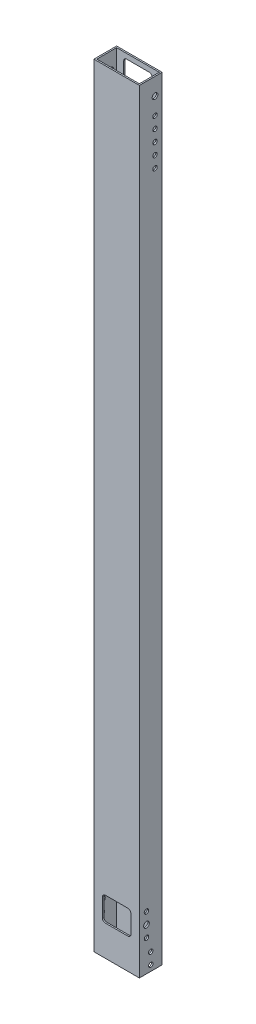
from build123d import *

# Parameters (mm, degrees)
SKETCH1_W               = 50.8
SKETCH1_H               = 863.6
BOSS_EXTRUDE1_DEPTH     = 12.7
SHELL1_T                = -1.5875
CUT_EXTRUDE1_DEPTH      = 433.73281595
CUT_EXTRUDE1_DEPTH_BACK = 433.73281595
SKETCH3_R               = 2.4892
CUT_EXTRUDE2_DEPTH      = 433.73281595
CUT_EXTRUDE2_DEPTH_BACK = 433.73281595
SKETCH4_R               = 3.175
SKETCH4_R_2             = 2.4892
SKETCH5_W               = 31.75
SKETCH5_H               = 26.9875
CUT_EXTRUDE3_DEPTH      = 433.73281595
FILLET1_R               = 3.175
CUT_EXTRUDE4_DEPTH      = 433.73281595
CUT_EXTRUDE4_DEPTH_BACK = 433.73281595
SKETCH6_R               = 3.175
SKETCH7_W               = 31.75
SKETCH7_H               = 26.9875
CUT_EXTRUDE5_DEPTH      = 433.73281595
FILLET2_R               = 3.175
CUT_EXTRUDE6_DEPTH      = 433.73281595
CUT_EXTRUDE6_DEPTH_BACK = 433.73281595
SKETCH8_R               = 2.4892


with BuildPart() as part:
    # Sketch1 → Boss-Extrude1 (new, symmetric)
    with BuildSketch(Plane.XY):
        Rectangle(SKETCH1_W, SKETCH1_H)
    extrude(amount=BOSS_EXTRUDE1_DEPTH, both=True)

    # Shell1
    shell1_openings = [part.faces().sort_by_distance(p)[0] for p in [
        (0, -431.8, 0),
        (0, 431.8, 0),
    ]]
    offset(amount=SHELL1_T, openings=shell1_openings, kind=Kind.INTERSECTION)

    # Sketch3 → Cut-Extrude1 (cut, two sides: drawn at the far end of the back side and taken through both)
    with BuildSketch(Plane(origin=(0, 0, 0), x_dir=(0, 0, -1), z_dir=(1, 0, 0)).offset(-CUT_EXTRUDE1_DEPTH_BACK)):
        with Locations((0, -425.45)):
            Circle(SKETCH3_R)
        with Locations((0, -412.75)):
            Circle(SKETCH3_R)
    extrude(amount=CUT_EXTRUDE1_DEPTH + CUT_EXTRUDE1_DEPTH_BACK, mode=Mode.SUBTRACT)

    # Sketch4 → Cut-Extrude2 (cut, two sides: drawn at the far end of the back side and taken through both)
    with BuildSketch(Plane(origin=(0, 0, 0), x_dir=(0, 0, -1), z_dir=(1, 0, 0)).offset(-CUT_EXTRUDE2_DEPTH_BACK)):
        with Locations((-4.7625, -384.175)):
            Circle(SKETCH4_R)
        with Locations((-4.7625, -371.475)):
            Circle(SKETCH4_R_2)
        with Locations((-4.7625, -396.875)):
            Circle(SKETCH4_R_2)
    extrude(amount=CUT_EXTRUDE2_DEPTH + CUT_EXTRUDE2_DEPTH_BACK, mode=Mode.SUBTRACT)

    # Sketch5 → Cut-Extrude3 (cut, through all)
    with BuildSketch(Plane.XY):
        with Locations((0, -384.175)):
            Rectangle(SKETCH5_W, SKETCH5_H)
    extrude(amount=CUT_EXTRUDE3_DEPTH, mode=Mode.SUBTRACT)

    # Fillet1
    fillet1_edges = [part.edges().sort_by_distance(p)[0] for p in [
        (-15.875, -397.66875, 11.90625),
        (15.875, -397.66875, 11.90625),
        (-15.875, -370.68125, 11.90625),
        (15.875, -370.68125, 11.90625),
    ]]
    fillet(fillet1_edges, radius=FILLET1_R)

    # Sketch6 → Cut-Extrude4 (cut, two sides: drawn at the far end of the back side and taken through both)
    with BuildSketch(Plane(origin=(0, 0, 0), x_dir=(0, 0, -1), z_dir=(1, 0, 0)).offset(-CUT_EXTRUDE4_DEPTH_BACK)):
        with Locations((4.7625, 412.75)):
            Circle(SKETCH6_R)
    extrude(amount=CUT_EXTRUDE4_DEPTH + CUT_EXTRUDE4_DEPTH_BACK, mode=Mode.SUBTRACT)

    # Sketch7 → Cut-Extrude5 (cut, through all)
    with BuildSketch(Plane.XY):
        with Locations((0, 412.75)):
            Rectangle(SKETCH7_W, SKETCH7_H)
    extrude(amount=-CUT_EXTRUDE5_DEPTH, mode=Mode.SUBTRACT)

    # Fillet2
    fillet2_edges = [part.edges().sort_by_distance(p)[0] for p in [
        (15.875, 399.25625, -11.90625),
        (-15.875, 399.25625, -11.90625),
        (-15.875, 426.24375, -11.90625),
        (15.875, 426.24375, -11.90625),
    ]]
    fillet(fillet2_edges, radius=FILLET2_R)

    # Sketch8 → Cut-Extrude6 (cut, two sides: drawn at the far end of the back side and taken through both)
    with BuildSketch(Plane(origin=(0, 0, 0), x_dir=(0, 0, -1), z_dir=(1, 0, 0)).offset(-CUT_EXTRUDE6_DEPTH_BACK)):
        with Locations((4.7625, 393.7)):
            Circle(SKETCH8_R)
        with Locations((4.7625, 381)):
            Circle(SKETCH8_R)
        with Locations((4.7625, 368.3)):
            Circle(SKETCH8_R)
        with Locations((4.7625, 355.6)):
            Circle(SKETCH8_R)
        with Locations((4.7625, 342.9)):
            Circle(SKETCH8_R)
    extrude(amount=CUT_EXTRUDE6_DEPTH + CUT_EXTRUDE6_DEPTH_BACK, mode=Mode.SUBTRACT)


solid = part.part
